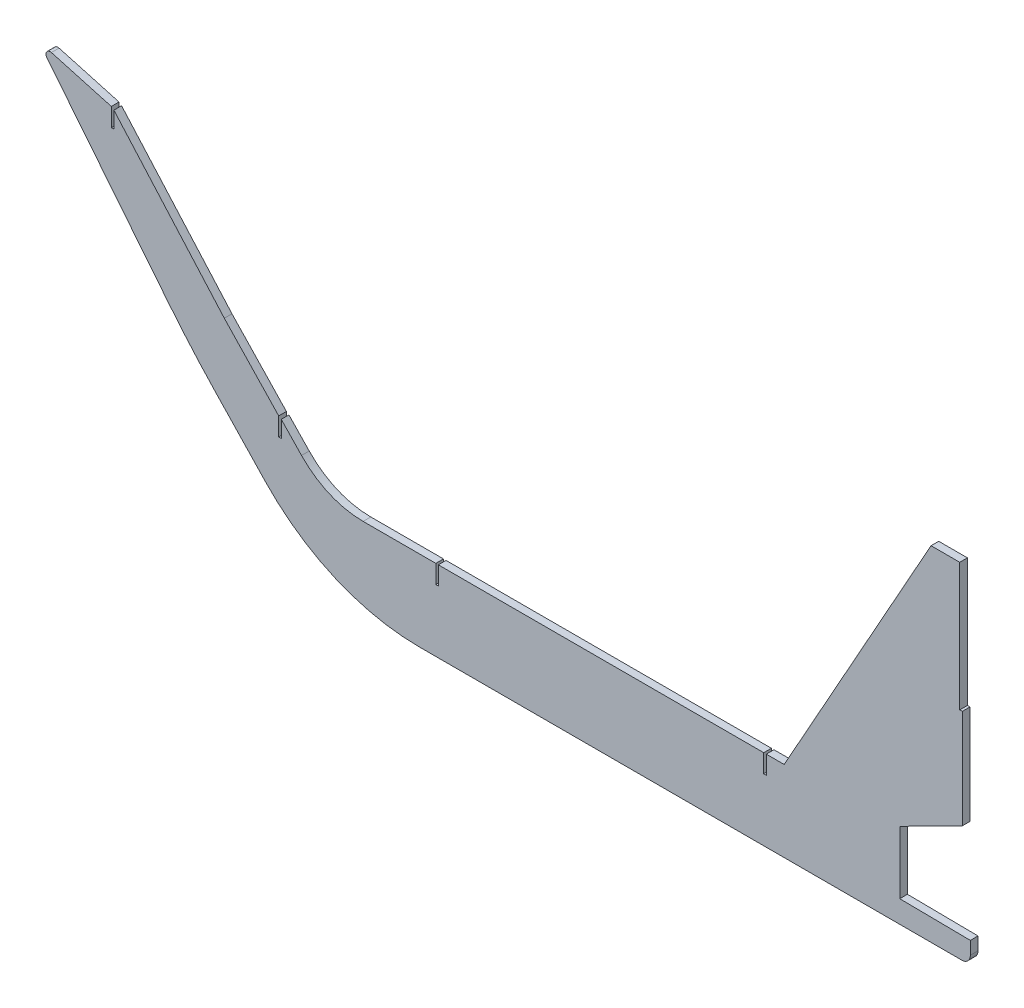
from build123d import *

# Parameters (mm, degrees)
BOSS_EXTRU_1_DEPTH = 9
CONG_1_R           = 1000
CONG_2_R           = 250
CONG_4_R           = 10
CONG_5_R           = 5
CONG_6_R           = 100


with BuildPart() as part:
    # Esquisse2 → Boss.-Extru.1 (new body)
    with BuildSketch(Plane.XY):
        Polygon((0, 0), (-753.514541491, 0), (-915.190229508, 170.50346618), (-1093.283519558, 392.387219436), (-1007.982904338, 368.608976512), (-1007.982904338, 347.108976512), (-1004.982904338, 347.108976512), (-1004.982904338, 366.343498655), (-875.399006988, 219.616732713), (-811.570765603, 152.303356597), (-811.570765603, 130.803356597), (-808.570765603, 130.803356597), (-808.570765603, 150.375814407), (-755.274625166, 94.639899826), (-627.232048759, 94.639899826), (-627.232048759, 73.139899826), (-624.232048759, 73.139899826), (-624.232048759, 94.639899826), (-242.444799847, 94.639899826), (-242.444799847, 73.139899826), (-239.444799847, 73.139899826), (-239.444799847, 94.639899826), (-218.449092799, 94.639899826), (-46.093252688, 403.139899826), (-12.434439882, 403.139899826), (-12.434439882, 253.139899826), (-9.434439882, 253.139899826), (-9.434439882, 136.779854294), (-82.801847324, 99.620582608), (-82.801847324, 26.059273195), (0, 25.118109707), align=None)
    extrude(amount=BOSS_EXTRU_1_DEPTH)

    # Congé1
    # the kernel refuses this fillet: 1000 mm, written as the material it takes off along each edge
    with BuildSketch(Plane(origin=(-915.190229508, 170.50346618, -103.157271439), x_dir=(0.6880722367162745, -0.7256421963063223, 0), z_dir=(0, 0, 1))) as cong_1_piece_1:
        with BuildLine():
            CenterArc((CONG_1_R * 0.0412629085755, CONG_1_R), CONG_1_R, 265.274299796, 4.725700204)
            Line((-CONG_1_R * 0.0411226366703, CONG_1_R * 0.00339946722142), (0, 0))
            Line((0, 0), (CONG_1_R * 0.0412629085755, 0))
        make_face()
    extrude(amount=215.314542878, mode=Mode.SUBTRACT)

    # Congé2
    cong_2_edges = [part.edges().sort_by_distance(p)[0] for p in [
        (-753.514541491, 0, 4.5),
    ]]
    fillet(cong_2_edges, radius=CONG_2_R)

    # Congé4
    cong_4_edges = [part.edges().sort_by_distance(p)[0] for p in [
        (0, 0, 4.5),
    ]]
    fillet(cong_4_edges, radius=CONG_4_R)

    # Congé5
    cong_5_edges = [part.edges().sort_by_distance(p)[0] for p in [
        (-1093.283519558, 392.387219436, 4.5),
    ]]
    fillet(cong_5_edges, radius=CONG_5_R)

    # Congé6
    cong_6_edges = [part.edges().sort_by_distance(p)[0] for p in [
        (-755.274625166, 94.639899826, 4.5),
    ]]
    fillet(cong_6_edges, radius=CONG_6_R)


solid = part.part
